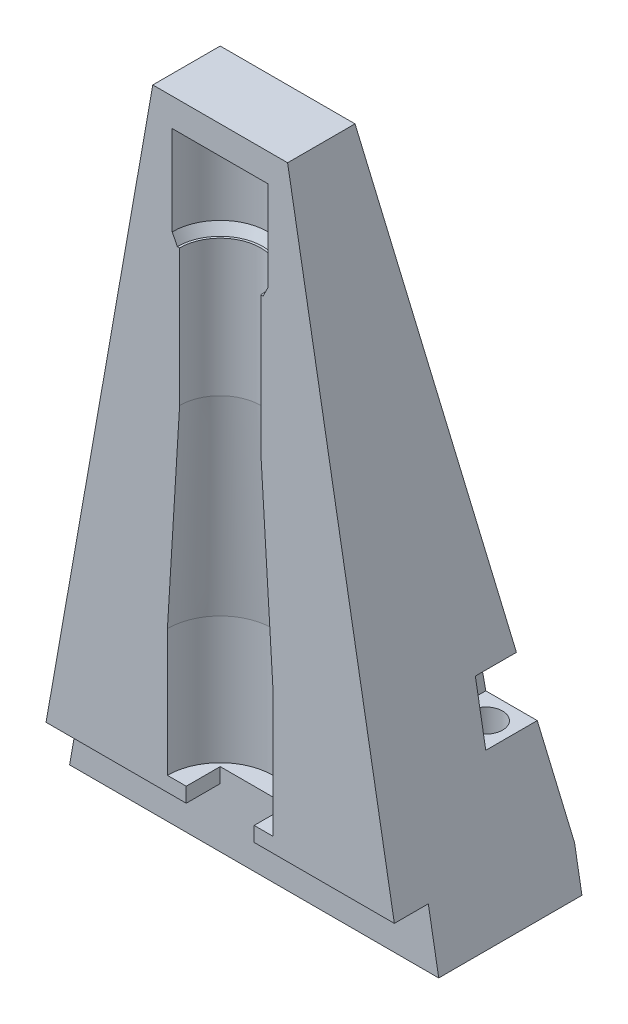
from build123d import *

# Parameters (mm, degrees)
SKETCH_2_W               = 50
SKETCH_2_H               = 50
EXTRUDE_1_DEPTH          = 90
EXTRUDE_1_TAPER          = 10
SKETCH_3_W               = 215.720321278
SKETCH_3_H               = 290.879799434
CUT_EXTRUDE_1_DEPTH      = 97.695398174
SKETCH_7_W               = 4.6
SKETCH_7_H               = 23.792731937
SKETCH_8_W               = 50
SKETCH_8_H               = 4.6
CUT_EXTRUDE_2_DEPTH      = 8
SKETCH_9_W               = 9.2
SKETCH_9_H               = 9.2
CUT_EXTRUDE_3_DEPTH      = 4.6
SKETCH_10_W              = 7
SKETCH_10_H              = 8
CUT_EXTRUDE_4_DEPTH      = 10.5
SKETCH_11_R              = 2.25
CUT_EXTRUDE_5_DEPTH      = 20
CUT_EXTRUDE_6_DEPTH      = 97.695398174
CUT_EXTRUDE_6_DEPTH_BACK = 97.695398174
SKETCH_12_W              = 75.055418853
SKETCH_12_H              = 23.361905794


with BuildPart() as part:
    # 草圖2 → 填料-伸長1 (new body)
    with BuildSketch(Plane(origin=(0, 0, 0), x_dir=(1, 0, 0), z_dir=(0, 1, 0))):
        Rectangle(SKETCH_2_W, SKETCH_2_H)
    extrude(amount=EXTRUDE_1_DEPTH, taper=EXTRUDE_1_TAPER)

    # 草圖3 → 除料-伸長1 (cut, through all)
    with BuildSketch(Plane.XY):
        Rectangle(SKETCH_3_W, SKETCH_3_H)
    extrude(amount=CUT_EXTRUDE_1_DEPTH, mode=Mode.SUBTRACT)


with BuildPart() as body_2:
    # stick_antenna_434MHz: read off the stored shape, not the designer's step
    # stick_antenna_434MHz outline → stick_antenna_434MHz (revolve)
    with BuildSketch(Plane.XY):
        Polygon((0, 86.2), (0, 10), (6.65, 10), (6.65, 27.2), (5, 54.2), (5, 73.2), (5.5, 73.2), (6, 74.2), (6, 86.2), align=None)
    revolve(axis=Axis((0, 0, 0), (0, 1, 0)))


with BuildPart() as part_1:
    add(part.part)

    # Other 1: read off the stored shape, not the designer's step
    # Other 1: cut body 2
    add(body_2.part, mode=Mode.SUBTRACT)

    # 草圖14 → 除料-旋轉2 (revolve, cut)
    with BuildSketch(Plane.XY):
        Polygon((7.15, 10), (0, 10), (0, 86.2), (6.5, 86.2), (6.5, 74.081966011), (5.809016994, 72.7), (5.5, 72.7), (5.5, 54.21526354), (7.15, 27.21526354), align=None)
    revolve(axis=Axis((0, 88.093709872, 0), (0, -1, 0)), mode=Mode.SUBTRACT)

    # 草圖7 → 除料-旋轉1 (revolve, cut)
    with BuildSketch(Plane.XY):
        with Locations((2.3, 11.896365969)):
            Rectangle(SKETCH_7_W, SKETCH_7_H)
    revolve(axis=Axis((0, 30.263839144, 0), (0, -1, 0)), mode=Mode.SUBTRACT)

    # 草圖8 → 除料-伸長2 (cut)
    with BuildSketch(Plane.XZ):
        with Locations((0, -2.3)):
            Rectangle(SKETCH_8_W, SKETCH_8_H)
    extrude(amount=-CUT_EXTRUDE_2_DEPTH, mode=Mode.SUBTRACT)

    # 草圖9 → 除料-伸長3 (cut)
    with BuildSketch(Plane.XY):
        with Locations((0, 5.4)):
            Rectangle(SKETCH_9_W, SKETCH_9_H)
    extrude(amount=-CUT_EXTRUDE_3_DEPTH, mode=Mode.SUBTRACT)

    # 草圖10 → 除料-伸長4 (cut)
    with BuildSketch(Plane.XY.offset(-25)):
        with Locations((-18, 24)):
            Rectangle(SKETCH_10_W, SKETCH_10_H)
    cut_extrude_4 = extrude(amount=CUT_EXTRUDE_4_DEPTH, mode=Mode.SUBTRACT)

    # 草圖11 → 除料-伸長5 (cut)
    with BuildSketch(Plane.XZ):
        with Locations(Location((-18, -18, 0), (0, 0, 270))):
            Circle(SKETCH_11_R)
        with Locations(Location((18, -18, 0), (0, 0, 90))):
            Circle(SKETCH_11_R)
    extrude(amount=-CUT_EXTRUDE_5_DEPTH, mode=Mode.SUBTRACT)

    # 鏡射2: 除料-伸長4 across plane
    add(cut_extrude_4.mirror(Plane(origin=(0, 0, 0), x_dir=(0, 0, 1), z_dir=(1, 0, 0))), mode=Mode.SUBTRACT)

    # 草圖12 → 除料-伸長6 (cut, two sides: drawn at the far end of the back side and taken through both)
    with BuildSketch(Plane(origin=(0, 0, 0), x_dir=(0, 0, -1), z_dir=(1, 0, 0)).offset(-CUT_EXTRUDE_6_DEPTH_BACK)):
        with Locations((61.527709427, 0)):
            Rectangle(SKETCH_12_W, SKETCH_12_H)
    extrude(amount=CUT_EXTRUDE_6_DEPTH + CUT_EXTRUDE_6_DEPTH_BACK, mode=Mode.SUBTRACT)


solid = part_1.part
